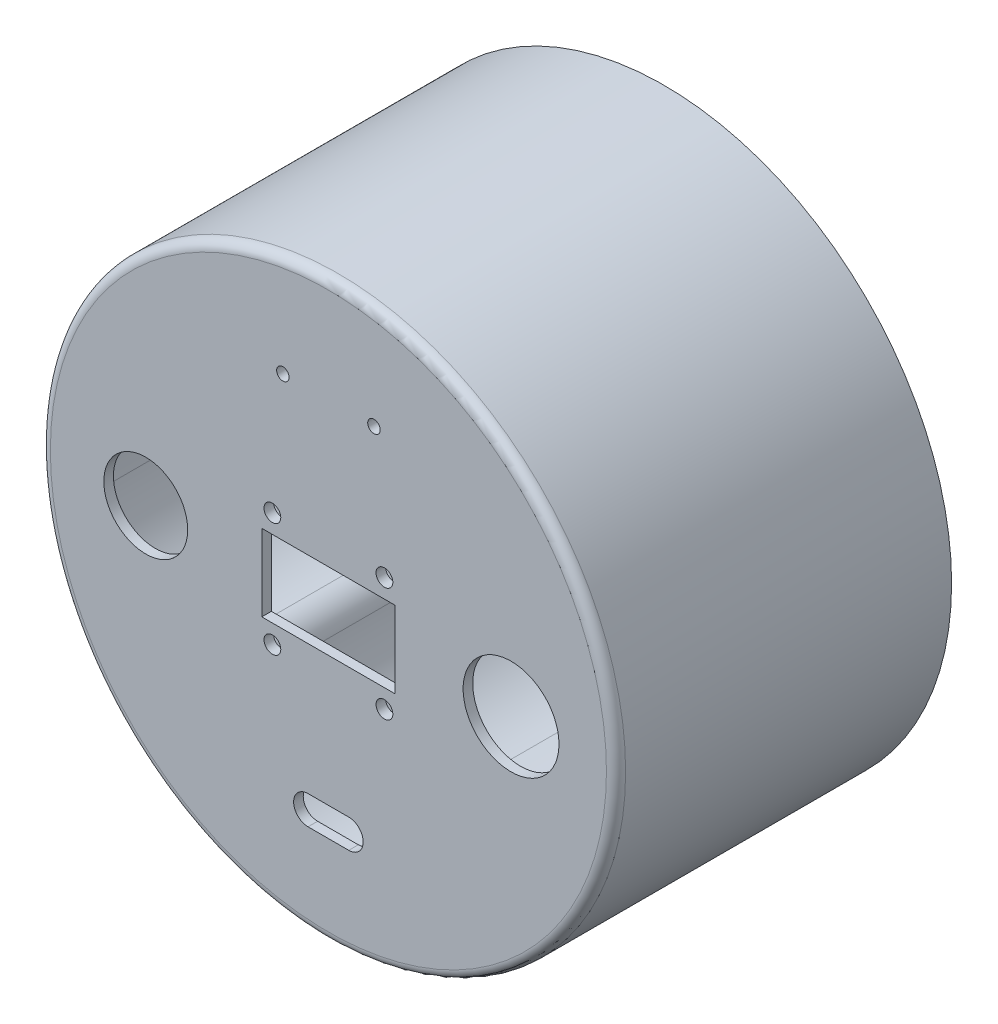
from build123d import *

# Parameters (mm, degrees)
SKETCH1_R                    = 60
BOSS_EXTRUDE1_DEPTH          = 70
FILLET2_R                    = 2
SKETCH3_R                    = 55
CUT_EXTRUDE3_DEPTH           = 68
CHAMFER1_SIZE                = 1
BOSS_EXTRUDE3_DEPTH          = 63
FILLET5_R                    = 24.75
M3_CLEARANCE_HOLE1_D         = 3.4
M3_CLEARANCE_HOLE1_DEPTH     = 10
M3_CLEARANCE_HOLE1_TIP       = 1.021463052
M22_CLEARANCE_HOLE1_D        = 20
M18_CLEARANCE_HOLE1_D        = 17.5
SKETCH19_R                   = 1.75
SKETCH19_W                   = 27.8
SKETCH19_H                   = 16
CUT_EXTRUDE4_DEPTH           = 111
CUT_EXTRUDE8_DEPTH           = 111
M2_START                     = 68
M2_CLEARANCE_HOLE1_OUTLINE_R = 1.3
M2_CLEARANCE_HOLE1_DEPTH     = 2


# Read off the part's stored shape, not the designer's step: M2 Clearance Hole1
with BuildPart() as part:
    # Sketch1 → Boss-Extrude1 (new body)
    with BuildSketch(Plane.XY):
        Circle(SKETCH1_R)
    extrude(amount=BOSS_EXTRUDE1_DEPTH)

    # Fillet2
    fillet2_edges = [part.edges().sort_by_distance(p)[0] for p in [
        (-60, 0, 70),
    ]]
    fillet(fillet2_edges, radius=FILLET2_R)

    # Sketch3 → Cut-Extrude3 (cut)
    with BuildSketch(Plane(origin=(0, 0, 0), x_dir=(-1, 0, 0), z_dir=(0, 0, -1))):
        Circle(SKETCH3_R)
    extrude(amount=-CUT_EXTRUDE3_DEPTH, mode=Mode.SUBTRACT)

    # Chamfer1
    chamfer1_edges = [part.edges().sort_by_distance(p)[0] for p in [
        (55, 0, 0),
    ]]
    chamfer(chamfer1_edges, length=CHAMFER1_SIZE)

    # Sketch9 → Boss-Extrude3 (add)
    with BuildSketch(Plane(origin=(0, 0, 5), x_dir=(-1, 0, 0), z_dir=(0, 0, -1))):
        with BuildLine():
            ThreePointArc((-37.067445653, 40.632554347), (-38.890872965, 38.890872965), (-40.632554347, 37.067445653))
            ThreePointArc((-40.632554347, 37.067445653), (-30.757359313, 30.757359313), (-37.067445653, 40.632554347))
        make_face()
        with BuildLine():
            ThreePointArc((-37.067445653, -40.632554347), (-30.757359313, -30.757359313), (-40.632554347, -37.067445653))
            ThreePointArc((-40.632554347, -37.067445653), (-38.890872965, -38.890872965), (-37.067445653, -40.632554347))
        make_face()
        with BuildLine():
            ThreePointArc((37.067445653, 40.632554347), (30.757359313, 30.757359313), (40.632554347, 37.067445653))
            ThreePointArc((40.632554347, 37.067445653), (38.890872965, 38.890872965), (37.067445653, 40.632554347))
        make_face()
        with BuildLine():
            ThreePointArc((40.632554347, -37.067445653), (30.757359313, -30.757359313), (37.067445653, -40.632554347))
            ThreePointArc((37.067445653, -40.632554347), (38.890872965, -38.890872965), (40.632554347, -37.067445653))
        make_face()
    extrude(amount=-BOSS_EXTRUDE3_DEPTH)

    # Fillet5
    fillet5_edges = [part.edges().sort_by_distance(p)[0] for p in [
        (37.067445653, -40.632554347, 36.5),
        (40.632554347, -37.067445653, 36.5),
        (-37.067445653, 40.632554347, 36.5),
        (-40.632554347, 37.067445653, 36.5),
        (-40.632554347, -37.067445653, 36.5),
        (-37.067445653, -40.632554347, 36.5),
        (37.067445653, 40.632554347, 36.5),
        (40.632554347, 37.067445653, 36.5),
    ]]
    fillet(fillet5_edges, radius=FILLET5_R)

    # M3 Clearance Hole1
    with Locations(Plane(origin=(0, 0, 5), x_dir=(-1, 0, 0), z_dir=(0, 0, -1))):
        with Locations((-35, -35), (0, 0), (-35, 35), (35, -35), (35, 35)):
            Hole(M3_CLEARANCE_HOLE1_D / 2, depth=M3_CLEARANCE_HOLE1_DEPTH)
            with Locations((0, 0, -(M3_CLEARANCE_HOLE1_DEPTH + M3_CLEARANCE_HOLE1_TIP / 2))):  # 118° drill point
                Cone(0, M3_CLEARANCE_HOLE1_D / 2, M3_CLEARANCE_HOLE1_TIP, mode=Mode.SUBTRACT)

    # M22 Clearance Hole1 (through all)
    with Locations(Plane.XY.offset(70)):
        with Locations((38.1, 0)):
            Hole(M22_CLEARANCE_HOLE1_D / 2)

    # M18 Clearance Hole1 (through all)
    with Locations(Plane.XY.offset(70)):
        with Locations((-38.1, 0)):
            Hole(M18_CLEARANCE_HOLE1_D / 2)

    # Sketch19 → Cut-Extrude4 (cut, through all)
    with BuildSketch(Plane.XY.offset(70)):
        with Locations((-11.685971223, 11.9)):
            Circle(SKETCH19_R)
        with Locations((11.685971223, 11.9)):
            Circle(SKETCH19_R)
        with Locations((11.685971223, -11.9)):
            Circle(SKETCH19_R)
        with Locations((-11.685971223, -11.9)):
            Circle(SKETCH19_R)
        Rectangle(SKETCH19_W, SKETCH19_H)
    extrude(amount=-CUT_EXTRUDE4_DEPTH, mode=Mode.SUBTRACT)

    # Sketch25 → Cut-Extrude8 (cut, through all)
    with BuildSketch(Plane.XY.offset(70)):
        with BuildLine():
            Line((-4.25, -35.1), (4.25, -35.1))
            ThreePointArc((4.25, -35.1), (7.25, -38.1), (4.25, -41.1))
            Line((4.25, -41.1), (-4.25, -41.1))
            ThreePointArc((-4.25, -41.1), (-7.25, -38.1), (-4.25, -35.1))
        make_face()
    extrude(amount=-CUT_EXTRUDE8_DEPTH, mode=Mode.SUBTRACT)

    # M2 Clearance Hole1 outline → M2 Clearance Hole1 (cut)
    with BuildSketch(Plane.XY.offset(M2_START)):
        with Locations((-9.5, 38.1)):
            Circle(M2_CLEARANCE_HOLE1_OUTLINE_R)
        with Locations((9.5, 38.1)):
            Circle(M2_CLEARANCE_HOLE1_OUTLINE_R)
    extrude(amount=M2_CLEARANCE_HOLE1_DEPTH, mode=Mode.SUBTRACT)


solid = part.part
